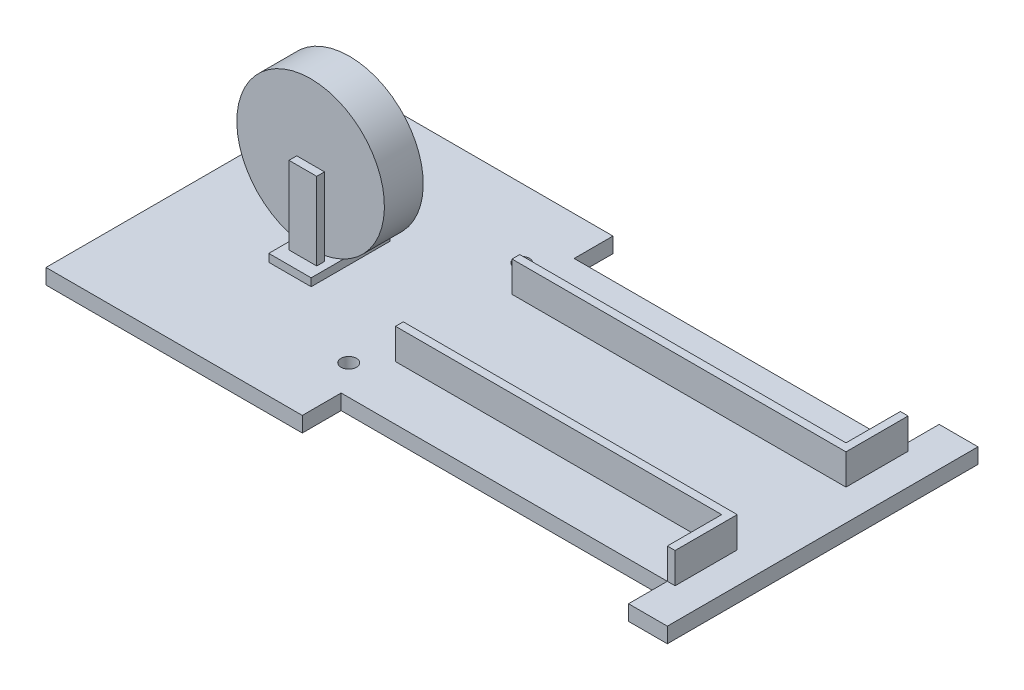
from build123d import *

# Parameters (mm, degrees)
BOSS_EXTRUDE1_DEPTH  = 5
BOSS_EXTRUDE2_DEPTH  = 10
SKETCH3_R            = 2.54
CUT_EXTRUDE1_DEPTH   = 115.031574575
SKETCH5_W            = 13.851899184
SKETCH5_H            = 25.842671822
BOSS_EXTRUDE3_DEPTH  = 2.54
SKETCH6_W            = 9.079065489
SKETCH6_H            = 2.54
BOSS_EXTRUDE7_DEPTH  = 25.4
SKETCH9_R            = 24.13
BOSS_EXTRUDE10_DEPTH = 12.7
SKETCH12_W           = 9.079065489
SKETCH12_H           = 25.611184956
BOSS_EXTRUDE11_DEPTH = 2.54


with BuildPart() as part:
    # Sketch1 → Boss-Extrude1 (new body)
    with BuildSketch(Plane(origin=(0, 0, 0), x_dir=(1, 0, 0), z_dir=(0, 1, 0))):
        Polygon((101.6, 50.8), (88.9, 50.8), (88.9, 38.1), (-17.78, 38.1), (-17.78, 50.8), (-101.6, 50.8), (-101.6, -50.8), (-17.78, -50.8), (-17.78, -38.1), (88.9, -38.1), (88.9, -50.8), (101.6, -50.8), align=None)
    extrude(amount=BOSS_EXTRUDE1_DEPTH)

    # Sketch2 → Boss-Extrude2 (add)
    with BuildSketch(Plane(origin=(0, 5, 0), x_dir=(1, 0, 0), z_dir=(0, 1, 0))):
        Polygon((88.9, -38.1), (88.9, -20.32), (-17.78, -20.32), (-17.78, -17.78), (91.44, -17.78), (91.44, -38.1), align=None)
        Polygon((91.44, 17.78), (91.44, 38.1), (88.9, 38.1), (88.9, 20.32), (-17.78, 20.32), (-17.78, 17.78), align=None)
    extrude(amount=BOSS_EXTRUDE2_DEPTH)

    # Sketch3 → Cut-Extrude1 (cut, through all)
    with BuildSketch(Plane(origin=(0, 5, 0), x_dir=(1, 0, 0), z_dir=(0, 1, 0))):
        with Locations((-25.086891482, 28.312348959)):
            Circle(SKETCH3_R)
        with Locations((-25.086891482, -28.312348959)):
            Circle(SKETCH3_R)
    extrude(amount=-CUT_EXTRUDE1_DEPTH, mode=Mode.SUBTRACT)

    # Sketch5 → Boss-Extrude3 (add)
    with BuildSketch(Plane(origin=(0, 5, 0), x_dir=(1, 0, 0), z_dir=(0, 1, 0))):
        with Locations((-59.69, 0)):
            Rectangle(SKETCH5_W, SKETCH5_H)
    extrude(amount=BOSS_EXTRUDE3_DEPTH)

    # Sketch6 → Boss-Extrude7 (add)
    with BuildSketch(Plane(origin=(0, 7.54, 0), x_dir=(1, 0, 0), z_dir=(0, 1, 0))):
        with Locations((-59.730694006, 7.841335911)):
            Rectangle(SKETCH6_W, SKETCH6_H)
    extrude(amount=BOSS_EXTRUDE7_DEPTH)

    # Sketch9 → Boss-Extrude10 (add)
    with BuildSketch(Plane.XY.offset(-6.571335911)):
        with Locations((-59.730694006, 32.94)):
            Circle(SKETCH9_R)
    extrude(amount=BOSS_EXTRUDE10_DEPTH)

    # Sketch12 → Boss-Extrude11 (add)
    with BuildSketch(Plane.XY.offset(6.128664089)):
        with Locations((-59.730694006, 20.134407522)):
            Rectangle(SKETCH12_W, SKETCH12_H)
    extrude(amount=BOSS_EXTRUDE11_DEPTH)


solid = part.part
